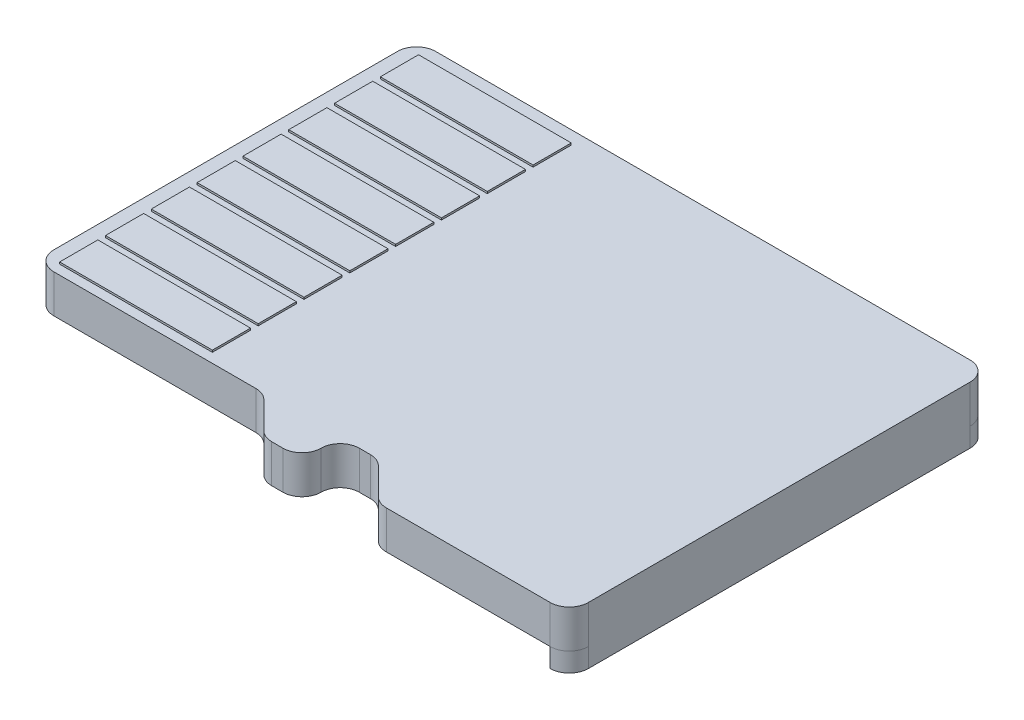
from build123d import *

# Parameters (mm, degrees)
SKETCH1_W           = 15
SKETCH1_H           = 10
BOSS_EXTRUDE1_DEPTH = 1
BOSS_EXTRUDE2_DEPTH = 1
BOSS_EXTRUDE3_DEPTH = 1
SKETCH4_W           = 4
SKETCH4_H           = 1
BOSS_EXTRUDE4_DEPTH = 0.05
LPATTERN1_COUNT     = 8
LPATTERN1_PITCH     = 1.2
FILLET1_R           = 0.5
BOSS_EXTRUDE5_DEPTH = 0.5
FILLET2_R           = 0.5


with BuildPart() as part:
    # Sketch1 → Boss-Extrude1 (new body)
    with BuildSketch(Plane(origin=(0, 0, 0), x_dir=(1, 0, 0), z_dir=(0, 1, 0))):
        Rectangle(SKETCH1_W, SKETCH1_H)
    extrude(amount=BOSS_EXTRUDE1_DEPTH)

    # Sketch2 → Boss-Extrude2 (add)
    with BuildSketch(Plane(origin=(0, 1, 0), x_dir=(1, 0, 0), z_dir=(0, 1, 0))):
        Polygon((7.5, -5), (7.5, -6), (2.5, -6), (1.5, -5), align=None)
    extrude(amount=-BOSS_EXTRUDE2_DEPTH)

    # Sketch3 → Boss-Extrude3 (add)
    with BuildSketch(Plane(origin=(0, 1, 0), x_dir=(1, 0, 0), z_dir=(0, 1, 0))):
        Polygon((0.5, -5), (0.5, -6), (-0.5, -6), (-1.5, -5), align=None)
    extrude(amount=-BOSS_EXTRUDE3_DEPTH)

    # Sketch4 → Boss-Extrude4 (add)
    with BuildSketch(Plane(origin=(0, 1, 0), x_dir=(1, 0, 0), z_dir=(0, 1, 0))):
        with Locations((-5.09817827, -4.25)):
            Rectangle(SKETCH4_W, SKETCH4_H)
    boss_extrude4 = extrude(amount=BOSS_EXTRUDE4_DEPTH)

    # LPattern1: Boss-Extrude4 ×8
    with Locations(*[(0, 0, -i * LPATTERN1_PITCH) for i in range(1, LPATTERN1_COUNT)]):
        add(boss_extrude4)

    # Fillet1
    fillet1_edges = [part.edges().sort_by_distance(p)[0] for p in [
        (-1.5, 0.5, 5),
        (1.5, 0.5, 5),
        (0.5, 0.5, 5),
        (2.5, 0.5, 6),
        (-0.5, 0.5, 6),
        (0.5, 0.5, 6),
        (7.5, 0.5, 6),
        (7.5, 0.5, -5),
        (-7.5, 0.5, -5),
        (-7.5, 0.5, 5),
    ]]
    fillet(fillet1_edges, radius=FILLET1_R - 0.0001)  # a hair under: the kernel refuses the full size

    # Sketch6 → Boss-Extrude5 (add)
    with BuildSketch(Plane.XZ):
        with BuildLine():
            Line((7.5, -5), (7.5, 6))
            Line((7.5, 6), (7, 6))
            ThreePointArc((7, 6), (6.073146166, 0.5), (7, -5))
            Line((7, -5), (7.5, -5))
        make_face()
    extrude(amount=BOSS_EXTRUDE5_DEPTH)

    # Fillet2
    fillet2_edges = [part.edges().sort_by_distance(p)[0] for p in [
        (7.5, -0.25, 6),
        (7.5, -0.25, -5),
    ]]
    fillet(fillet2_edges, radius=FILLET2_R - 0.0001)  # a hair under: the kernel refuses the full size


solid = part.part
